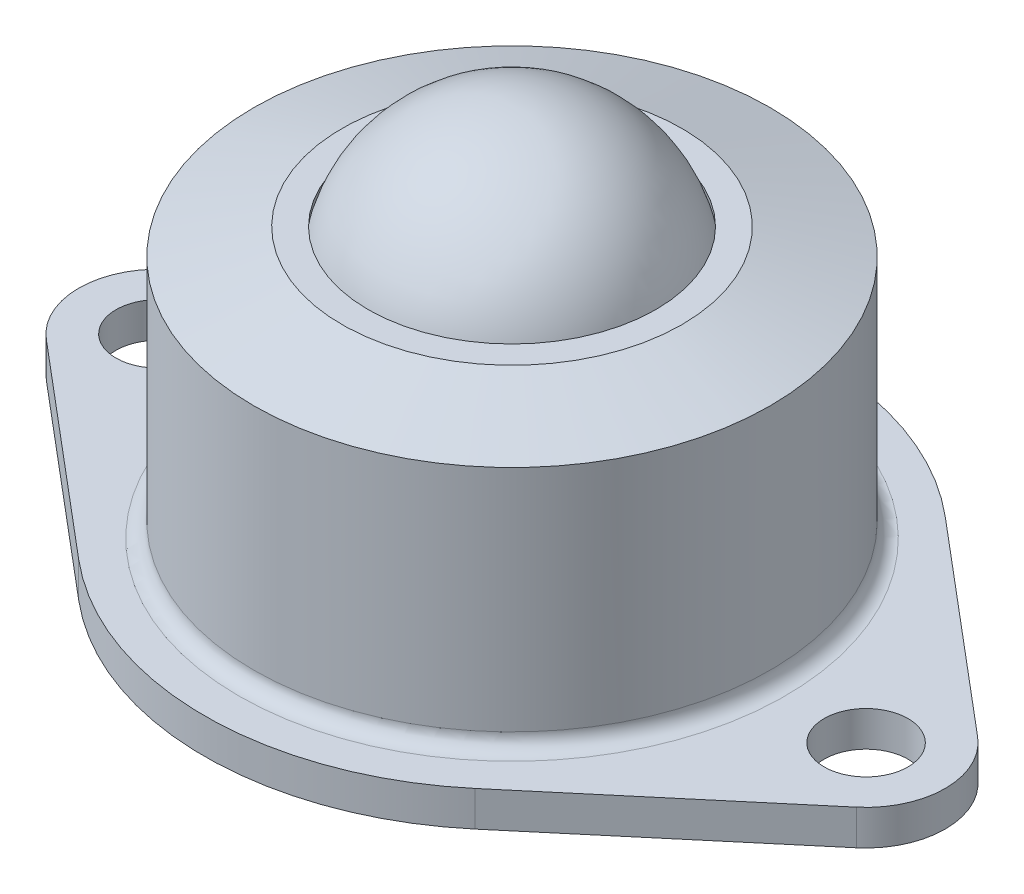
from build123d import *

# Parameters (mm, degrees)
SKETCH2_R           = 3.571875
BOSS_EXTRUDE1_DEPTH = 3
SKETCH1_W           = 22
SKETCH1_H           = 26
FILLET1_R           = 1.27


# Read off the part's stored shape, not the designer's step: Move Face1
with BuildPart() as part:
    # Sketch2 → Boss-Extrude1 (new body)
    with BuildSketch(Plane(origin=(0, 0, 0), x_dir=(1, 0, 0), z_dir=(0, 1, 0))):
        with BuildLine():
            Line((-16.888075658, 20.022623196), (-34.512458882, 5.157342338))
            ThreePointArc((-34.512458882, 5.157342338), (-36.909375, 0), (-34.512458882, -5.157342338))
            Line((-34.512458882, -5.157342338), (-16.888075658, -20.022623196))
            ThreePointArc((-16.888075658, -20.022623196), (0, -26.19375), (16.888075658, -20.022623196))
            Line((16.888075658, -20.022623196), (34.512458882, -5.157342338))
            ThreePointArc((34.512458882, -5.157342338), (36.909375, 0), (34.512458882, 5.157342338))
            Line((34.512458882, 5.157342338), (16.888075658, 20.022623196))
            ThreePointArc((16.888075658, 20.022623196), (0, 26.19375), (-16.888075658, 20.022623196))
        make_face()
        with Locations(Location((-30.1625, 0, 0), (0, 0, 270))):
            Circle(SKETCH2_R, mode=Mode.SUBTRACT)
        with Locations(Location((30.1625, 0, 0), (0, 0, 270))):
            Circle(SKETCH2_R, mode=Mode.SUBTRACT)
    extrude(amount=BOSS_EXTRUDE1_DEPTH)

    # Sketch1 → Revolve1 (revolve)
    with BuildSketch(Plane.XY, mode=Mode.PRIVATE) as revolve1_sk:
        with Locations((11, 13)):
            Rectangle(SKETCH1_W, SKETCH1_H)
    revolve(revolve1_sk.sketch.rotate(Axis((0, 26, 0), (0, -1, 0)), 180), axis=Axis((0, 26, 0), (0, -1, 0)))

    # Sketch3<2> → Cut-Revolve1 (revolve, cut)
    with BuildSketch(Plane.XY):
        with BuildLine():
            Line((0, 34.925), (0, 9.525))
            ThreePointArc((0, 9.525), (12.7, 22.225), (0, 34.925))
        make_face()
    revolve(axis=Axis((0, 34.925, 0), (0, -1, 0)), mode=Mode.SUBTRACT)

    # Move Face1 outline → Move Face1 (revolve, cut)
    with BuildSketch(Plane.XY):
        with BuildLine():
            Line((0, 9.525), (0, 9.398))
            ThreePointArc((0, 9.398), (10.318765773, 14.605616697), (12.258927519, 26.000000012))
            Line((12.258927519, 26.000000012), (12.125979338, 26.000000012))
            ThreePointArc((12.125979338, 26.000000012), (10.228208547, 14.69680301), (0, 9.525))
        make_face()
    revolve(axis=Axis((0, 0, 0), (0, 1, 0)), mode=Mode.SUBTRACT)

    # Fillet1
    fillet1_edges = [part.edges().sort_by_distance(p)[0] for p in [
        (22, 3, 0),
    ]]
    fillet(fillet1_edges, radius=FILLET1_R)

    # Sketch4 → Cut-Revolve2 (revolve, cut)
    with BuildSketch(Plane.XY):
        Polygon((22, 23.7744), (14.478, 26), (22, 26), align=None)
    revolve(axis=Axis((0, 26, 0), (0, 1, 0)), mode=Mode.SUBTRACT)


with BuildPart() as body_2:
    # Sketch3 → Revolve2 (revolve)
    with BuildSketch(Plane.XY):
        with BuildLine():
            Line((0, 34.925), (0, 9.525))
            ThreePointArc((0, 9.525), (12.7, 22.225), (0, 34.925))
        make_face()
    revolve(axis=Axis((0, 34.925, 0), (0, -1, 0)))


solid = Compound([part.part, body_2.part])
